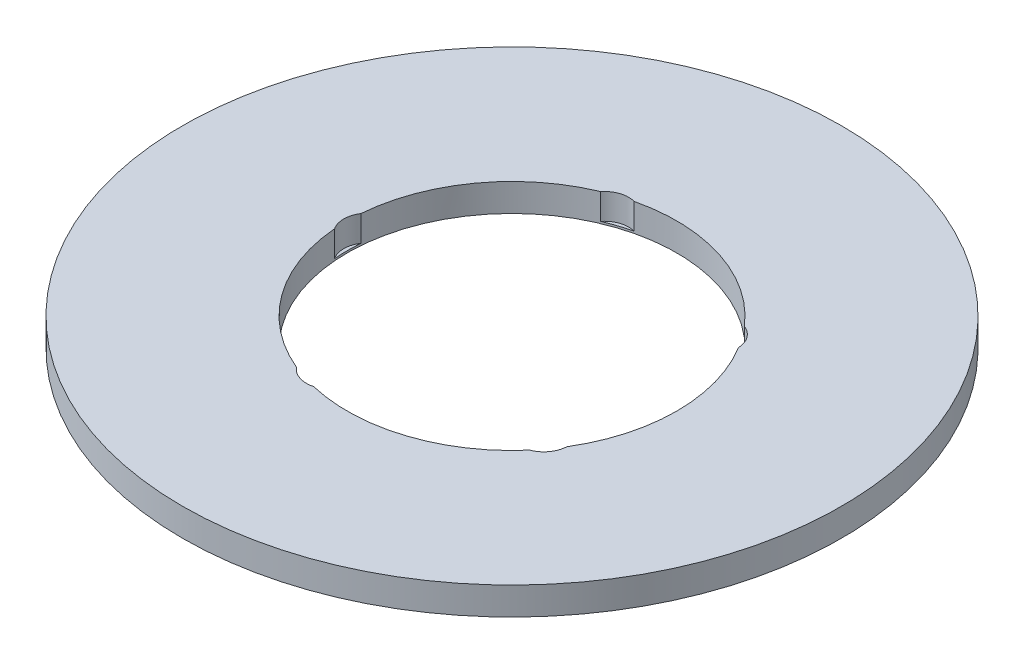
from build123d import *

# Parameters (mm, degrees)
SKETCH1_R           = 95
BOSS_EXTRUDE1_DEPTH = 8
SKETCH2_R           = 47.5
CUT_EXTRUDE1_DEPTH  = 135.588261004
SKETCH3_R           = 6.991522803
CUT_EXTRUDE2_DEPTH  = 7.434651836
CIRPATTERN1_COUNT   = 5


with BuildPart() as part:
    # Sketch1 → Boss-Extrude1 (new body)
    with BuildSketch(Plane(origin=(0, 0, 0), x_dir=(1, 0, 0), z_dir=(0, 1, 0))):
        Circle(SKETCH1_R)
    extrude(amount=BOSS_EXTRUDE1_DEPTH)

    # Sketch2 → Cut-Extrude1 (cut, through all)
    with BuildSketch(Plane(origin=(0, 0, 0), x_dir=(1, 0, 0), z_dir=(0, 1, 0))):
        Circle(SKETCH2_R)
    extrude(amount=CUT_EXTRUDE1_DEPTH, mode=Mode.SUBTRACT)

    # Sketch3 → Cut-Extrude2 (cut)
    with BuildSketch(Plane(origin=(0, 8, 0), x_dir=(1, 0, 0), z_dir=(0, 1, 0))):
        with Locations((-41.491762002, 0)):
            Circle(SKETCH3_R)
    cut_extrude2 = extrude(amount=-CUT_EXTRUDE2_DEPTH, mode=Mode.SUBTRACT)

    # CirPattern1: Cut-Extrude2 ×5 about axis
    cirpattern1_axis = Axis((0, 0, 0), (0, 1, 0))
    for i in range(1, CIRPATTERN1_COUNT):
        add(cut_extrude2.rotate(cirpattern1_axis, i * 360 / CIRPATTERN1_COUNT), mode=Mode.SUBTRACT)


solid = part.part
